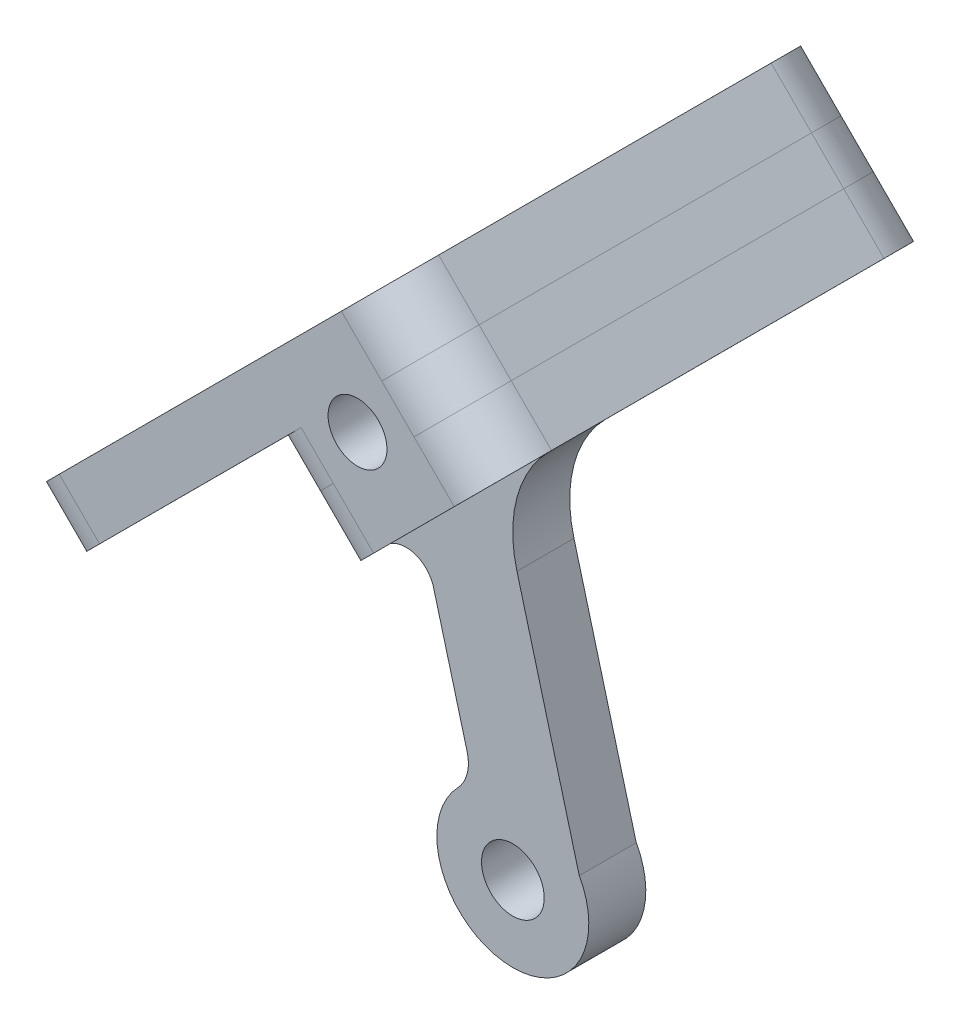
from build123d import *

# Parameters (mm, degrees)
SKETCH_1_R           = 1.55
SKETCH_1_R_2         = 1.65
EXTRUDE_1_DEPTH      = 3
EXTRUDE_5_DEPTH      = 3
EXTRUDE_5_DEPTH_BACK = 20.5
SKETCH_2_R           = 1.55
SKETCH_3_W           = 2.999466183
SKETCH_3_H           = 23.5
EXTRUDE_9_DEPTH      = 15
CUT_EXTRUDE_1_DEPTH  = 43.137686458
CUT_EXTRUDE_2_DEPTH  = 41.555271529
SKETCH_6_R           = 1.55
CUT_EXTRUDE_3_DEPTH  = 10
FILLET_1_R           = 3
FILLET_2_R           = 3
FILLET_3_R           = 3


with BuildPart() as part:
    # 草图1 → 凸台-拉伸1 (new body)
    with BuildSketch(Plane(origin=(0, 0, -3.362857667), x_dir=(-1, 0, 0), z_dir=(0, 0, -1))):
        with BuildLine():
            Line((-8.929456987, 17.45330102), (-12.208534908, 5.216337034))
            ThreePointArc((-12.208534908, 5.216337034), (-8.203956956, -0.691485495), (-5.819308033, 6.03550946))
            ThreePointArc((-5.819308033, 6.03550946), (-6.310108859, 6.921233679), (-6.304159928, 7.933833034))
            Line((-6.304159928, 7.933833034), (-4.539684391, 14.518557193))
            ThreePointArc((-4.539684391, 14.518557193), (-3.62301138, 15.532716808), (-2.264294404, 15.382060533))
            Line((-2.264294404, 15.382060533), (-0.142530428, 17.503217343))
            Line((-0.142530428, 17.503217343), (4.099819599, 13.25965297))
            Line((4.099819599, 13.25965297), (5.797509256, 14.956856814))
            Line((5.797509256, 14.956856814), (1.554532399, 19.201048196))
            Line((1.554532399, 19.201048196), (3.675778765, 21.321687543))
            Line((3.675778765, 21.321687543), (-4.808443123, 29.808337985))
            Line((-4.808443123, 29.808337985), (-6.931968366, 27.685420414))
            Line((-6.931968366, 27.685420414), (-11.173246227, 31.927912314))
            Line((-11.173246227, 31.927912314), (-12.870428791, 30.231215419))
            Line((-12.870428791, 30.231215419), (-8.629080401, 25.98865297))
            Line((-8.629080401, 25.98865297), (-10.749072595, 23.869267436))
            Line((-10.749072595, 23.869267436), (-10.611098311, 23.731253658))
            ThreePointArc((-10.611098311, 23.731253658), (-8.929299443, 20.817545637), (-8.929456987, 17.45330102))
        make_face()
        with Locations(Location((-3.536567574, 22.593983824, 0), (0, 0, 180))):
            Circle(SKETCH_1_R, mode=Mode.SUBTRACT)
        with Locations(Location((-8.71249984, 3.274951558, 0), (0, 0, 180))):
            Circle(SKETCH_1_R_2, mode=Mode.SUBTRACT)
    extrude(amount=-EXTRUDE_1_DEPTH)

    # 草图2 → 凸台-拉伸5 (add, two sides: drawn at the far end of the back side and taken through both)
    with BuildSketch(Plane.XY.offset(-0.362857667).offset(-EXTRUDE_5_DEPTH_BACK)):
        Polygon((6.931968366, 27.685420414), (4.808443123, 29.808337985), (-3.675778765, 21.321687543), (-1.554532399, 19.201048196), (-1.554756221, 19.20082431), (-5.797509256, 14.956856814), (-4.099819599, 13.25965297), (0.142530428, 17.503217343), (0.142754305, 17.503441284), (2.264294404, 15.382060533), (10.611098311, 23.731253658), (10.748516293, 23.868710975), (10.749072595, 23.869267436), (8.629080401, 25.98865297), (12.870358263, 30.23114487), (11.173246227, 31.927912314), align=None)
        with Locations((3.536567574, 22.593983824)):
            Circle(SKETCH_2_R, mode=Mode.SUBTRACT)
    extrude(amount=EXTRUDE_5_DEPTH + EXTRUDE_5_DEPTH_BACK)

    # 草图3 → 凸台-拉伸9 (add)
    with BuildSketch(Plane(origin=(8.823479961, 8.826005625, 0), x_dir=(0.7072079618145243, -0.7070055860784599, 0), z_dir=(-0.7070055860784599, -0.7072079618145243, 0))):
        with Locations((-16.174359114, -9.112857667)):
            Rectangle(SKETCH_3_W, SKETCH_3_H)
    extrude(amount=EXTRUDE_9_DEPTH)

    # 草图4 → 切除-拉伸1 (cut, through all)
    with BuildSketch(Plane(origin=(0, 0, -20.862857667), x_dir=(-1, 0, 0), z_dir=(0, 0, -1))):
        Polygon((-11.306274604, 32.060978769), (-13.003386639, 30.364211325), (-8.629080401, 25.98865297), (-6.931968366, 27.685420414), align=None)
    extrude(amount=-CUT_EXTRUDE_1_DEPTH, mode=Mode.SUBTRACT)

    # 草图5 → 切除-拉伸2 (cut, through all)
    with BuildSketch(Plane(origin=(0, 0, -20.862857667), x_dir=(-1, 0, 0), z_dir=(0, 0, -1))):
        Polygon((-0.142754305, 17.503441284), (4.099819599, 13.25965297), (5.797509256, 14.956856814), (1.554935352, 19.200645127), align=None)
    extrude(amount=-CUT_EXTRUDE_2_DEPTH, mode=Mode.SUBTRACT)

    # 草图6 → 切除-拉伸3 (cut)
    with BuildSketch(Plane(origin=(-10.37801236, 10.375042572, 0), x_dir=(0, 0, -1), z_dir=(0.7072079618145242, -0.7070055860784599, 0))):
        with Locations(Location((0.112857667, 6.48007107, 0), (0, 0, 90))):
            Circle(SKETCH_6_R)
        with Locations(Location((18.112857667, 6.48007107, 0), (0, 0, 90))):
            Circle(SKETCH_6_R)
    extrude(amount=-CUT_EXTRUDE_3_DEPTH, mode=Mode.SUBTRACT)

    # 圆角1
    fillet_1_edges = [part.edges().sort_by_distance(p)[0] for p in [
        (-0.706090524, 18.352043206, 2.637142333),
        (-0.706090524, 18.352043206, -20.862857667),
        (1.203524355, 16.442750908, -20.862857667),
        (1.203524355, 16.442750908, 2.637142333),
    ]]
    fillet(fillet_1_edges, radius=FILLET_1_R - 0.0001)  # a hair under: the kernel refuses the full size

    # 圆角2
    fillet_2_edges = [part.edges().sort_by_distance(p)[0] for p in [
        (7.780524383, 26.837036692, 2.637142333),
        (7.780524383, 26.837036692, -20.862857667),
        (9.689076498, 24.928960203, -20.862857667),
        (5.870205744, 28.746879199, -20.862857667),
        (9.689076498, 24.928960203, 2.637142333),
        (5.870205744, 28.746879199, 2.637142333),
    ]]
    fillet(fillet_2_edges, radius=FILLET_2_R)

    # 圆角3
    fillet_3_edges = [part.edges().sort_by_distance(p)[0] for p in [
        (-13.220239373, 9.653248443, -20.862857667),
        (-13.220239373, 9.653248443, 2.637142333),
    ]]
    fillet(fillet_3_edges, radius=FILLET_3_R)


solid = part.part
